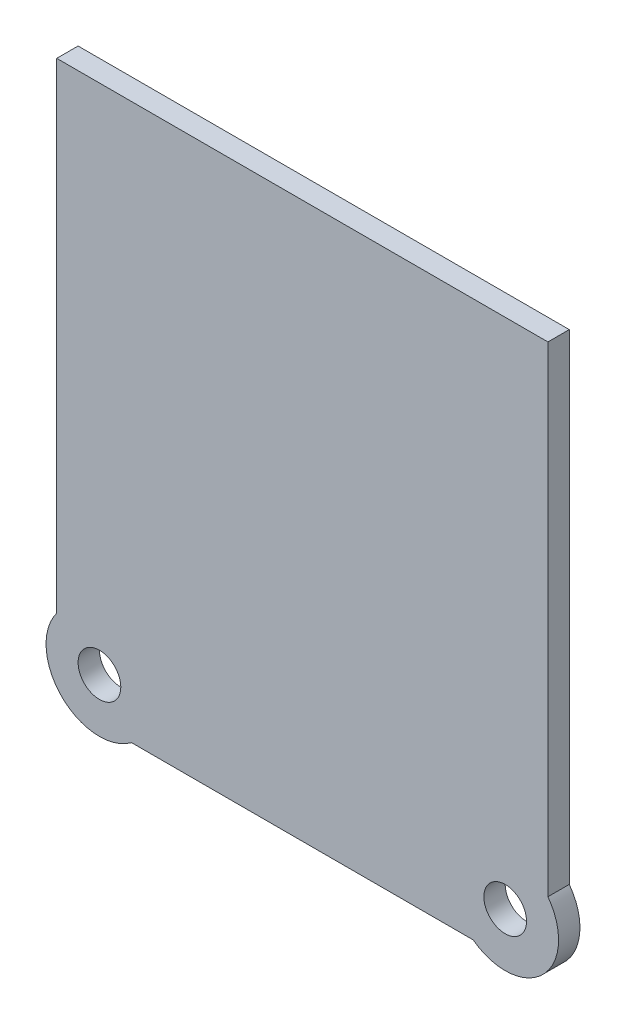
from build123d import *

# Parameters (mm, degrees)
SKETCH1_R           = 6.35
BOSS_EXTRUDE1_DEPTH = 3.175


with BuildPart() as part:
    # Sketch1 → Boss-Extrude1 (new, symmetric)
    with BuildSketch(Plane.XY):
        with BuildLine():
            Line((-0.002676144, -12.7), (0.002676144, -12.7))
            Line((0.002676144, -12.7), (50.8, -12.7))
            ThreePointArc((50.8, -12.7), (71.550320151, -11.225320151), (73.025, 9.525))
            Line((73.025, 9.525), (73.025, 152.4))
            Line((73.025, 152.4), (-73.025, 152.4))
            Line((-73.025, 152.4), (-73.025, 9.525))
            ThreePointArc((-73.025, 9.525), (-71.550320151, -11.225320151), (-50.8, -12.7))
            Line((-50.8, -12.7), (-0.002676144, -12.7))
        make_face()
        with Locations((-60.325, 0)):
            Circle(SKETCH1_R, mode=Mode.SUBTRACT)
        with Locations((60.325, 0)):
            Circle(SKETCH1_R, mode=Mode.SUBTRACT)
    extrude(amount=BOSS_EXTRUDE1_DEPTH, both=True)


solid = part.part
